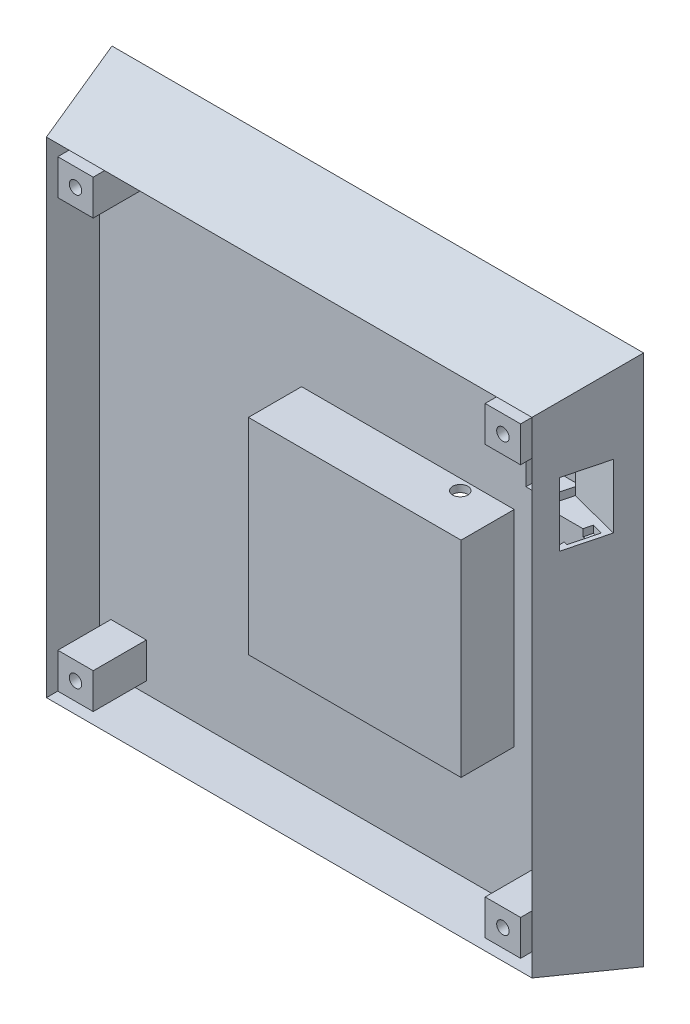
from build123d import *

# Parameters (mm, degrees)
ESQUISSE1_W                  = 150
ESQUISSE1_H                  = 150
BOSS_EXTRU_1_DEPTH           = 25
CHANFREIN1_SIZE              = 25
CHANFREIN1_SIZE_2            = 6.5
ESQUISSE2_W                  = 137
ESQUISSE2_H                  = 137
ESQUISSE2_W_2                = 10
ESQUISSE2_H_2                = 10
ESQUISSE2_W_3                = 60
ESQUISSE2_H_3                = 58
ESQUISSE2_R                  = 1.75
ENL_V_MAT_EXTRU_2_DEPTH      = 15
ESQUISSE3_W                  = 12.5
ESQUISSE3_H                  = 18
ENL_V_MAT_EXTRU_3_DEPTH      = 15
ENL_V_MAT_EXTRU_4_DEPTH      = 20
ENL_V_MAT_EXTRU_4_DEPTH_BACK = 2
ESQUISSE5_W                  = 60
ESQUISSE5_H                  = 58
ESQUISSE5_W_2                = 56
ESQUISSE5_H_2                = 54
ENL_V_MAT_EXTRU_7_DEPTH      = 8
ESQUISSE6_W                  = 56
ESQUISSE6_H                  = 54
ENL_V_MAT_EXTRU_6_DEPTH      = 22
ESQUISSE7_W                  = 8
ESQUISSE7_H                  = 4
ENL_V_MAT_EXTRU_13_DEPTH     = 8
ESQUISSE8_R                  = 2.14482531
ENL_V_MAT_EXTRU_9_DEPTH      = 8
ESQUISSE9_R                  = 4.485216979
ESQUISSE9_R_2                = 4.690098516
ESQUISSE9_R_3                = 4.770954249
ESQUISSE9_R_4                = 4.498432912
ENL_V_MAT_EXTRU_10_DEPTH     = 22
ESQUISSE10_W                 = 6.913683137
ESQUISSE10_H                 = 8.110809872
ENL_V_MAT_EXTRU_11_DEPTH     = 8
ESQUISSE11_W                 = 10
ESQUISSE11_H                 = 4
ENL_V_MAT_EXTRU_12_DEPTH     = 8


with BuildPart() as part:
    # Esquisse1 → Boss.-Extru.1 (new body)
    with BuildSketch(Plane.XY):
        with Locations((75, 75)):
            Rectangle(ESQUISSE1_W, ESQUISSE1_H)
    extrude(amount=BOSS_EXTRU_1_DEPTH)

    # Chanfrein1
    # the kernel refuses this chamfer: 25, 6.5 mm, written as the material it takes off along each edge
    with BuildSketch(Plane(origin=(150, -64.922604179, 25), x_dir=(0.00968976271621493, 0, -0.9999530531472482), z_dir=(0, 1, 0)), Plane(origin=(214.922604179, 150, 25), x_dir=(0, 0.00968976271621493, -0.9999530531472482), z_dir=(-1, 0, 0)), Plane(origin=(0, 214.922604179, 25), x_dir=(-0.009689762716214955, 0, -0.9999530531472482), z_dir=(0, -1, 0)), Plane(origin=(-64.922604179, 0, 25), x_dir=(0, -0.009689762716214955, -0.9999530531472482), z_dir=(1, 0, 0))) as chanfrein1_piece_1:
        Polygon((CHANFREIN1_SIZE * 0.999953053147, CHANFREIN1_SIZE * 0.00968976271621), (-CHANFREIN1_SIZE_2 * 0.00968976271621, CHANFREIN1_SIZE_2 * 0.999953053147), (0, 0), align=None)
    extrude(amount=279.845208358, mode=Mode.SUBTRACT)

    # Esquisse2 → Enlèv. mat.-Extru.2 (cut)
    # profile 1 of 5: a face of its own
    with BuildSketch(Plane.XY.offset(25)):
        with Locations((75, 75)):
            Rectangle(ESQUISSE2_W, ESQUISSE2_H)
        with Locations((14.7, 14.7)):
            Rectangle(ESQUISSE2_W_2, ESQUISSE2_H_2, mode=Mode.SUBTRACT)
        with Locations((135.3, 14.7)):
            Rectangle(ESQUISSE2_W_2, ESQUISSE2_H_2, mode=Mode.SUBTRACT)
        with Locations((93.5, 74.5)):
            Rectangle(ESQUISSE2_W_3, ESQUISSE2_H_3, mode=Mode.SUBTRACT)
        with Locations((14.7, 135.3)):
            Rectangle(ESQUISSE2_W_2, ESQUISSE2_H_2, mode=Mode.SUBTRACT)
        with Locations((135.3, 135.3)):
            Rectangle(ESQUISSE2_W_2, ESQUISSE2_H_2, mode=Mode.SUBTRACT)
    # profile 2 of 5: a face of its own
    with BuildSketch(Plane.XY.offset(25)):
        with Locations((14.7, 135.3)):
            Circle(ESQUISSE2_R)
    # profile 3 of 5: a face of its own
    with BuildSketch(Plane.XY.offset(25)):
        with Locations((135.3, 135.3)):
            Circle(ESQUISSE2_R)
    # profile 4 of 5: a face of its own
    with BuildSketch(Plane.XY.offset(25)):
        with Locations((135.3, 14.7)):
            Circle(ESQUISSE2_R)
    # profile 5 of 5: a face of its own
    with BuildSketch(Plane.XY.offset(25)):
        with Locations((14.7, 14.7)):
            Circle(ESQUISSE2_R)
    extrude(amount=-ENL_V_MAT_EXTRU_2_DEPTH, mode=Mode.SUBTRACT)

    # Esquisse3 → Enlèv. mat.-Extru.3 (cut)
    with BuildSketch(Plane(origin=(140.502060697, 0, 36.530535781), x_dir=(0.2516338517649486, 0, -0.9678225067882726), z_dir=(0.9678225067882725, 0, 0.25163385176494857))):
        with Locations((24.495077765, 117.5)):
            Rectangle(ESQUISSE3_W, ESQUISSE3_H)
    extrude(amount=-ENL_V_MAT_EXTRU_3_DEPTH, mode=Mode.SUBTRACT)

    # Esquisse4 → Enlèv. mat.-Extru.4 (cut, two sides: drawn at the far end of the back side and taken through both)
    with BuildSketch(Plane(origin=(0, 108.5, 0), x_dir=(1, 0, 0), z_dir=(0, 1, 0)).offset(-ENL_V_MAT_EXTRU_4_DEPTH_BACK)):
        Polygon((146.541727915, -8.467609261), (144.547390296, -16.138138565), (141.512044488, -15.348948655), (143.506382107, -7.678419351), align=None)
    extrude(amount=ENL_V_MAT_EXTRU_4_DEPTH + ENL_V_MAT_EXTRU_4_DEPTH_BACK, mode=Mode.SUBTRACT)

    # Esquisse5 → Enlèv. mat.-Extru.7 (cut)
    # profile 1 of 2: a face of its own
    with BuildSketch(Plane(origin=(0, 0, 0), x_dir=(-1, 0, 0), z_dir=(0, 0, -1))):
        Polygon((-125.912264941, 103.398684795), (-125.912264941, 143.5), (-25.60196638, 143.5), (-25.60196638, 125.072705698), (-6.5, 125.072705698), (-6.5, 27.173820188), (-25.60196638, 27.173820188), (-25.60196638, 6.5), (-125.912264941, 6.5), (-125.912264941, 27.173820188), (-143.5, 27.173820188), (-143.5, 103.398684795), align=None)
        with Locations((-93.5, 74.5)):
            Rectangle(ESQUISSE5_W, ESQUISSE5_H, mode=Mode.SUBTRACT)
    # profile 2 of 2: a face of its own
    with BuildSketch(Plane(origin=(0, 0, 0), x_dir=(-1, 0, 0), z_dir=(0, 0, -1))):
        with Locations((-93.5, 74.5)):
            Rectangle(ESQUISSE5_W_2, ESQUISSE5_H_2)
    extrude(amount=-ENL_V_MAT_EXTRU_7_DEPTH, mode=Mode.SUBTRACT)

    # Esquisse6 → Enlèv. mat.-Extru.6 (cut)
    with BuildSketch(Plane(origin=(0, 0, 0), x_dir=(-1, 0, 0), z_dir=(0, 0, -1))):
        with Locations((-93.5, 74.5)):
            Rectangle(ESQUISSE6_W, ESQUISSE6_H)
    extrude(amount=-ENL_V_MAT_EXTRU_6_DEPTH, mode=Mode.SUBTRACT)

    # Esquisse7 → Enlèv. mat.-Extru.13 (cut)
    with BuildSketch(Plane.XZ.offset(-101.640366459)):
        with Locations((74.5, 4)):
            Rectangle(ESQUISSE7_W, ESQUISSE7_H)
        with Locations((112.5, 4)):
            Rectangle(ESQUISSE7_W, ESQUISSE7_H)
    extrude(amount=-ENL_V_MAT_EXTRU_13_DEPTH, mode=Mode.SUBTRACT)

    # Esquisse8 → Enlèv. mat.-Extru.9 (cut)
    with BuildSketch(Plane(origin=(0, 103.5, 0), x_dir=(1, 0, 0), z_dir=(0, 1, 0))):
        with Locations(Location((111.298002562, -13.017125877, 0), (0, 0, 180))):
            Circle(ESQUISSE8_R)
    extrude(amount=-ENL_V_MAT_EXTRU_9_DEPTH, mode=Mode.SUBTRACT)

    # Esquisse9 → Enlèv. mat.-Extru.10 (cut)
    with BuildSketch(Plane(origin=(0, 0, 0), x_dir=(-1, 0, 0), z_dir=(0, 0, -1))):
        with Locations((-135.3, 135.3)):
            Circle(ESQUISSE9_R)
        with Locations((-14.7, 135.3)):
            Circle(ESQUISSE9_R_2)
        with Locations((-14.7, 14.7)):
            Circle(ESQUISSE9_R_3)
        with Locations((-135.3, 14.7)):
            Circle(ESQUISSE9_R_4)
    extrude(amount=-ENL_V_MAT_EXTRU_10_DEPTH, mode=Mode.SUBTRACT)

    # Esquisse10 → Enlèv. mat.-Extru.11 (cut)
    with BuildSketch(Plane.XY.offset(10)):
        with Locations((130.264383867, 114.747246467)):
            Rectangle(ESQUISSE10_W, ESQUISSE10_H)
    extrude(amount=-ENL_V_MAT_EXTRU_11_DEPTH, mode=Mode.SUBTRACT)

    # Esquisse11 → Enlèv. mat.-Extru.12 (cut)
    with BuildSketch(Plane(origin=(0, 47.359633541, 0), x_dir=(1, 0, 0), z_dir=(0, 1, 0))):
        with Locations((94.5, -4)):
            Rectangle(ESQUISSE11_W, ESQUISSE11_H)
    extrude(amount=-ENL_V_MAT_EXTRU_12_DEPTH, mode=Mode.SUBTRACT)


solid = part.part
